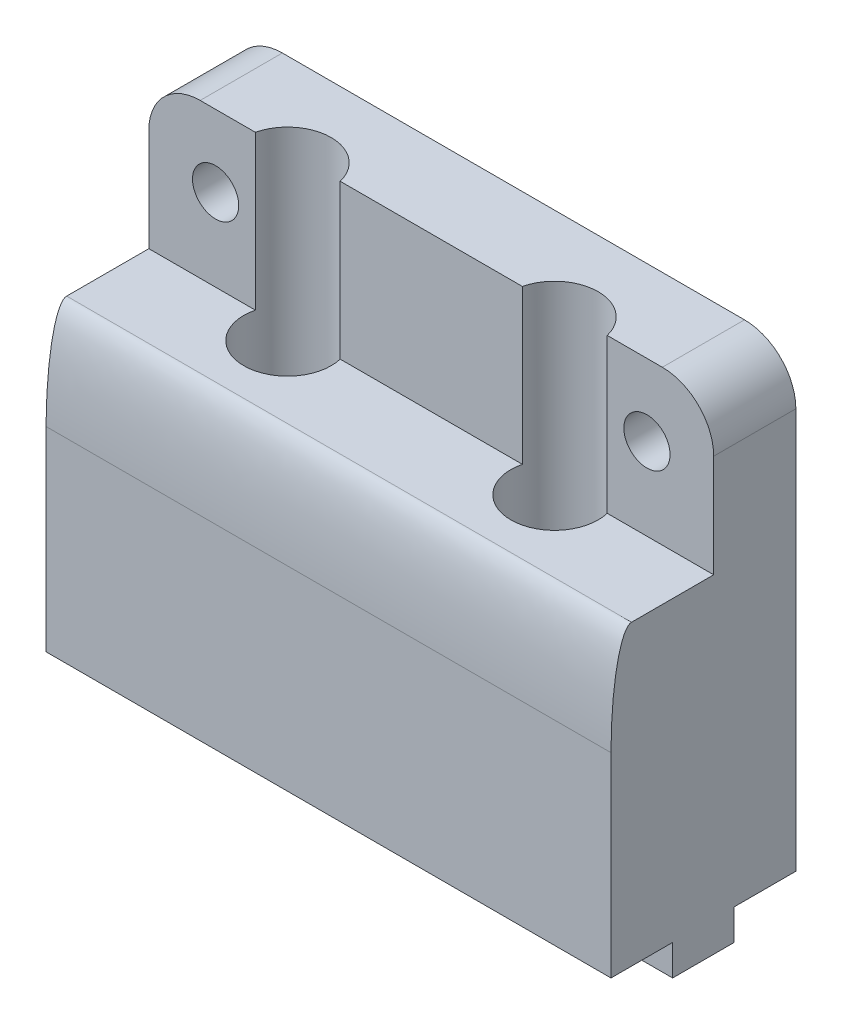
from build123d import *

# Parameters (mm, degrees)
SKETCH_1_W          = 55
SKETCH_1_H          = 18
EXTRUDE_1_DEPTH     = 44
SKETCH_2_R          = 2.25
CUT_EXTRUDE_1_DEPTH = 40
SKETCH_3_R          = 2.25
CUT_EXTRUDE_2_DEPTH = 50
SKETCH_4_R          = 4.25
CUT_EXTRUDE_3_DEPTH = 22
CUT_EXTRUDE_START   = -4
SKETCH_5_R          = 2.25
CUT_EXTRUDE_4_DEPTH = 4
FILLET_1_R          = 5
SKETCH_6_W          = 8
SKETCH_6_H          = 6
EXTRUDE_2_DEPTH     = 3
SKETCH_7_W          = 71.435921238
SKETCH_7_H          = 28.786378212
CUT_EXTRUDE_5_DEPTH = 10
FILLET_2_SIZE       = 10
FILLET_2_SIZE_2     = 2


with BuildPart() as part:
    # Эскиз1 → Бобышка-Вытянуть1 (new body)
    with BuildSketch(Plane(origin=(0, 0, 0), x_dir=(1, 0, 0), z_dir=(0, 1, 0))):
        with Locations((27.5, 9)):
            Rectangle(SKETCH_1_W, SKETCH_1_H)
    extrude(amount=EXTRUDE_1_DEPTH)

    # Эскиз2 → Вырез-Вытянуть1 (cut)
    with BuildSketch(Plane.XY):
        with Locations((48.5, 37)):
            Circle(SKETCH_2_R)
        with Locations((6.5, 37)):
            Circle(SKETCH_2_R)
    extrude(amount=-CUT_EXTRUDE_1_DEPTH, mode=Mode.SUBTRACT)

    # Эскиз3 → Вырез-Вытянуть2 (cut)
    with BuildSketch(Plane(origin=(0, 44, 0), x_dir=(1, 0, 0), z_dir=(0, 1, 0))):
        with Locations(Location((40.5, 9, 0), (0, 0, 270))):
            Circle(SKETCH_3_R)
        with Locations(Location((14.5, 9, 0), (0, 0, 90))):
            Circle(SKETCH_3_R)
    extrude(amount=-CUT_EXTRUDE_2_DEPTH, mode=Mode.SUBTRACT)

    # Эскиз4 → Вырез-Вытянуть3 (cut)
    with BuildSketch(Plane(origin=(0, 44, 0), x_dir=(1, 0, 0), z_dir=(0, 1, 0))):
        with Locations(Location((40.5, 9, 0), (0, 0, 270))):
            Circle(SKETCH_4_R)
        with Locations(Location((14.5, 9, 0), (0, 0, 270))):
            Circle(SKETCH_4_R)
    extrude(amount=-CUT_EXTRUDE_3_DEPTH, mode=Mode.SUBTRACT)

    # Эскиз5 → Вырез-Вытянуть4 (cut)
    # profile 1 of 2: a face of its own
    with BuildSketch(Plane(origin=(0, 0, -18), x_dir=(-1, 0, 0), z_dir=(0, 0, -1)).offset(CUT_EXTRUDE_START)):
        Polygon((-52.772391992, 37), (-50.636195996, 33.3), (-46.363804004, 33.3), (-44.227608008, 37), (-46.363804004, 40.7), (-50.636195996, 40.7), align=None)
        with Locations((-48.5, 37)):
            Circle(SKETCH_5_R, mode=Mode.SUBTRACT)
    # profile 2 of 2: a face of its own
    with BuildSketch(Plane(origin=(0, 0, -18), x_dir=(-1, 0, 0), z_dir=(0, 0, -1)).offset(CUT_EXTRUDE_START)):
        Polygon((-10.772391992, 37), (-8.636195996, 33.3), (-4.363804004, 33.3), (-2.227608008, 37), (-4.363804004, 40.7), (-8.636195996, 40.7), align=None)
        with Locations(Location((-6.5, 37, 0), (0, 0, 180))):
            Circle(SKETCH_5_R, mode=Mode.SUBTRACT)
    extrude(amount=CUT_EXTRUDE_4_DEPTH, mode=Mode.SUBTRACT)

    # Скругление1
    fillet_1_edges = [part.edges().sort_by_distance(p)[0] for p in [
        (55, 44, -9),
        (0, 44, -9),
    ]]
    fillet(fillet_1_edges, radius=FILLET_1_R)

    # Эскиз6 → Бобышка-Вытянуть2 (add)
    with BuildSketch(Plane.XZ):
        with Locations((51, -9)):
            Rectangle(SKETCH_6_W, SKETCH_6_H)
        with Locations((4, -9)):
            Rectangle(SKETCH_6_W, SKETCH_6_H)
    extrude(amount=EXTRUDE_2_DEPTH)

    # Эскиз7 → Вырез-Вытянуть5 (cut)
    with BuildSketch(Plane.XY):
        with Locations((35.717960619, 43.393189106)):
            Rectangle(SKETCH_7_W, SKETCH_7_H)
    extrude(amount=-CUT_EXTRUDE_5_DEPTH, mode=Mode.SUBTRACT)

    # Скругление2
    # an asymmetric fillet: 10, 2 mm, written as the material it takes off along each edge
    with BuildSketch(Plane(origin=(-25, 29, 0), x_dir=(0, -1, 0), z_dir=(1, 0, 0))) as fillet_2_piece_1:
        with BuildLine():
            Bezier((FILLET_2_SIZE, 0), (0, 0), (0, FILLET_2_SIZE_2), weights=[1, 0.707106781, 1])
            Line((0, FILLET_2_SIZE_2), (0, 0))
            Line((0, 0), (FILLET_2_SIZE, 0))
        make_face()
    extrude(amount=105, mode=Mode.SUBTRACT)


solid = part.part
